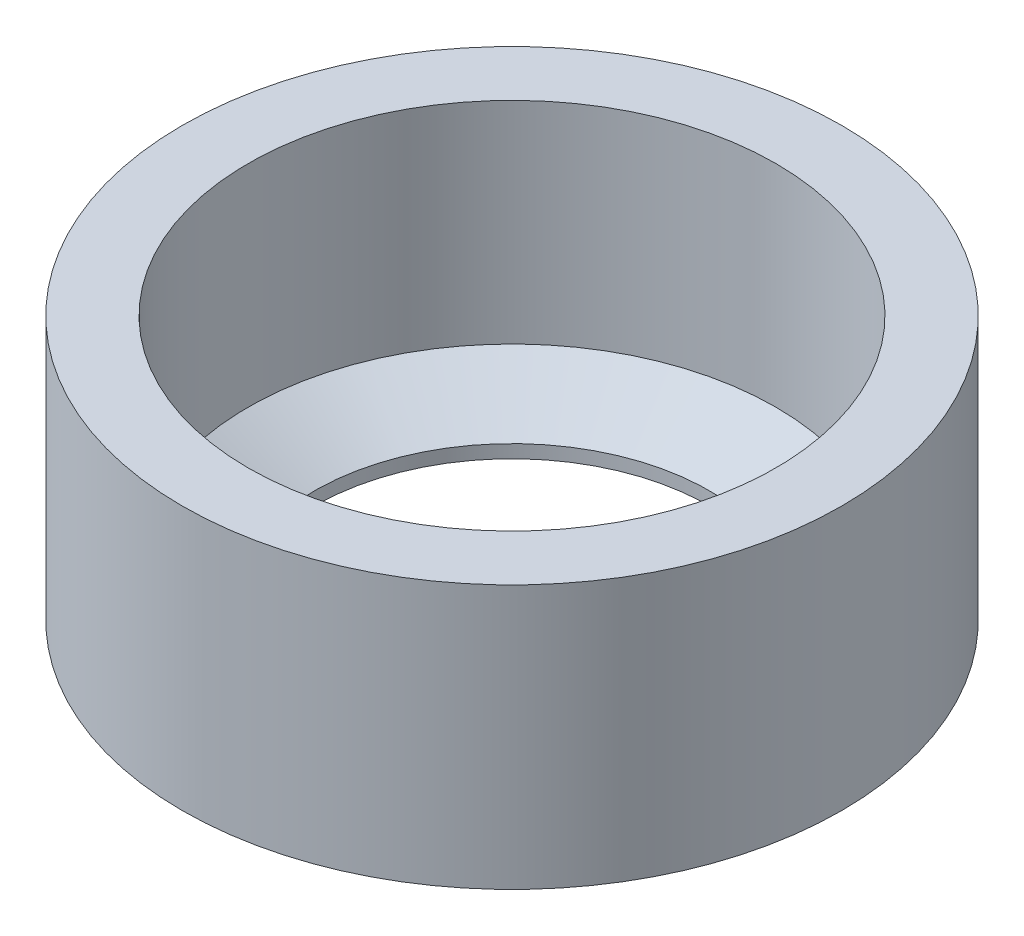
from build123d import *

# Parameters (mm, degrees)
SKETCH1_R                   = 15.875
BOSS_EXTRUDE1_DEPTH         = 12.7
F_1_1_DIAMETER_HOLE1_D      = 25.4
F_1_1_DIAMETER_HOLE1_DEPTH  = 10.16
F_1_1_DIAMETER_HOLE1_TIP    = 7.630929862
F_3_4_0_75_DIAMETER_HOLE1_D = 19.05


with BuildPart() as part:
    # Sketch1 → Boss-Extrude1 (new body)
    with BuildSketch(Plane(origin=(0, 0, 0), x_dir=(1, 0, 0), z_dir=(0, 1, 0))):
        Circle(SKETCH1_R)
    extrude(amount=BOSS_EXTRUDE1_DEPTH)

    # 1 (1) Diameter Hole1
    with Locations(Plane.ZX.offset(12.7)):
        with Locations((0, 0)):
            Hole(F_1_1_DIAMETER_HOLE1_D / 2, depth=F_1_1_DIAMETER_HOLE1_DEPTH)
            with Locations((0, 0, -(F_1_1_DIAMETER_HOLE1_DEPTH + F_1_1_DIAMETER_HOLE1_TIP / 2))):  # 118° drill point
                Cone(0, F_1_1_DIAMETER_HOLE1_D / 2, F_1_1_DIAMETER_HOLE1_TIP, mode=Mode.SUBTRACT)

    # 3/4 (0.75) Diameter Hole1 (through all)
    with Locations(Plane.ZX.offset(12.7)):
        with Locations((0, 0)):
            Hole(F_3_4_0_75_DIAMETER_HOLE1_D / 2)


solid = part.part
